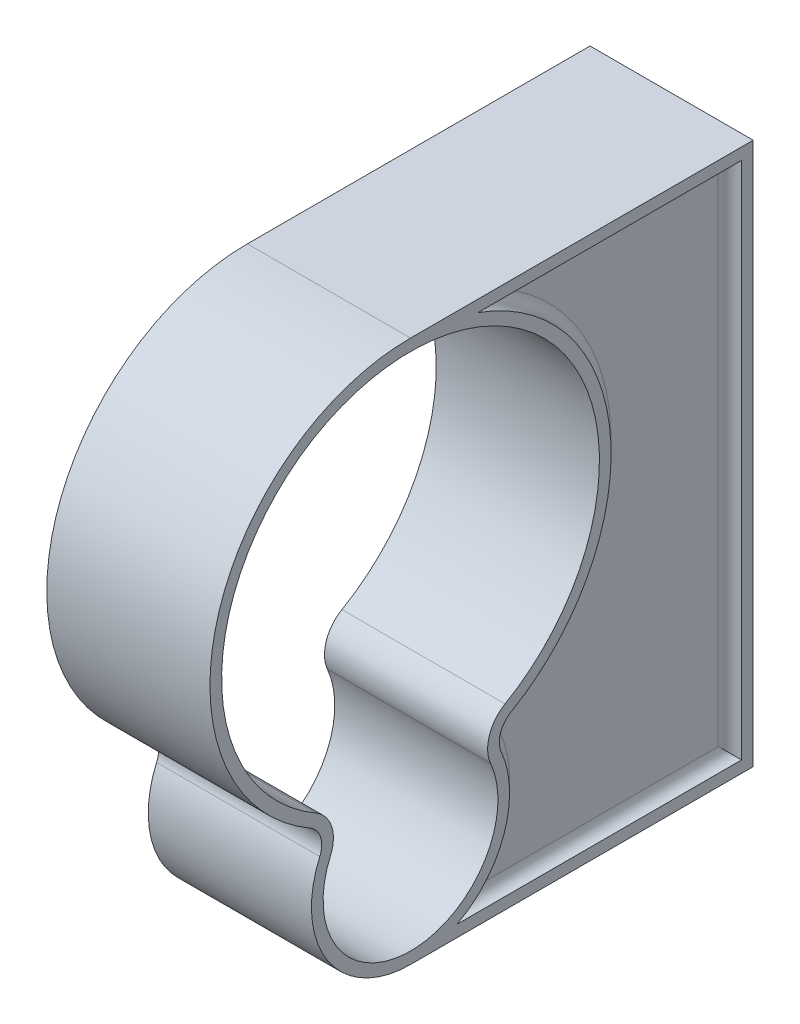
from build123d import *

# Parameters (mm, degrees)
BOSS_EXTRUDE1_DEPTH = 140
SKETCH2_R           = 15
CUT_EXTRUDE1_DEPTH  = 140
CUT_EXTRUDE2_START  = -10
CUT_EXTRUDE2_DEPTH  = 10
CUT_EXTRUDE3_DEPTH  = 10
FILLET1_R           = 10


with BuildPart() as part:
    # Sketch1 → Boss-Extrude1 (new body)
    with BuildSketch(Plane(origin=(0, 0, 0), x_dir=(0, 0, -1), z_dir=(1, 0, 0))):
        with BuildLine():
            Line((0, -120.66577438), (293.9982389, -120.66577438))
            Line((293.9982389, -120.66577438), (293.9982389, 344.79792692))
            Line((293.9982389, 344.79792692), (0, 344.79792692))
            ThreePointArc((0, 344.79792692), (-166.188863738, 217.33208751), (-86.160329475, 23.781803731))
            ThreePointArc((-86.160329475, 23.781803731), (-77.169593528, 12.698658653), (-77.855834661, -1.556112857))
            ThreePointArc((-77.855834661, -1.556112857), (-71.148862357, -82.172111425), (0, -120.66577438))
        make_face()
        with BuildLine():
            ThreePointArc((81.153066922, 32.43786067), (0, 334.79792692), (-81.153066922, 32.43786067))
            ThreePointArc((-81.153066922, 32.43786067), (-67.666963002, 15.813143052), (-68.696324701, -5.569014213))
            ThreePointArc((-68.696324701, -5.569014213), (0, -110.66577438), (68.696324701, -5.569014213))
            ThreePointArc((68.696324701, -5.569014213), (67.666963002, 15.813143052), (81.153066922, 32.43786067))
        make_face(mode=Mode.SUBTRACT)
    extrude(amount=BOSS_EXTRUDE1_DEPTH)

    # Sketch2 → Cut-Extrude1 (cut)
    with BuildSketch(Plane(origin=(0, 0, -293.9982389), x_dir=(-1, 0, 0), z_dir=(0, 0, -1))):
        with Locations((-110, 314.79792692)):
            Circle(SKETCH2_R)
        with Locations((-30, -90.66577438)):
            Circle(SKETCH2_R)
        with Locations((-110, -90.66577438)):
            Circle(SKETCH2_R)
        with Locations((-30, 314.79792692)):
            Circle(SKETCH2_R)
    extrude(amount=-CUT_EXTRUDE1_DEPTH, mode=Mode.SUBTRACT)

    # Sketch3 → Cut-Extrude2 (cut)
    with BuildSketch(Plane(origin=(140, 0, 0), x_dir=(0, 0, -1), z_dir=(1, 0, 0)).offset(CUT_EXTRUDE2_START)):
        with BuildLine():
            Line((40, -110.66577438), (283.9982389, -110.66577438))
            Line((283.9982389, -110.66577438), (283.9982389, 334.79792692))
            Line((283.9982389, 334.79792692), (57.804969406, 334.79792692))
            ThreePointArc((57.804969406, 334.79792692), (171.360027548, 188.350107316), (86.160329475, 23.781803731))
            ThreePointArc((86.160329475, 23.781803731), (77.169593528, 12.698658653), (77.855834661, -1.556112857))
            ThreePointArc((77.855834661, -1.556112857), (80.303978733, -63.527414671), (40, -110.66577438))
        make_face()
    extrude(amount=CUT_EXTRUDE2_DEPTH, mode=Mode.SUBTRACT)

    # Sketch4 → Cut-Extrude3 (cut)
    with BuildSketch(Plane.ZY):
        with BuildLine():
            Line((-57.804969406, 334.79792692), (-283.9982389, 334.79792692))
            Line((-283.9982389, 334.79792692), (-283.9982389, -110.66577438))
            Line((-283.9982389, -110.66577438), (-40, -110.66577438))
            ThreePointArc((-40, -110.66577438), (-80.303978733, -63.527414671), (-77.855834661, -1.556112857))
            ThreePointArc((-77.855834661, -1.556112857), (-77.169593528, 12.698658653), (-86.160329475, 23.781803731))
            ThreePointArc((-86.160329475, 23.781803731), (-171.360027548, 188.350107316), (-57.804969406, 334.79792692))
        make_face()
    extrude(amount=-CUT_EXTRUDE3_DEPTH, mode=Mode.SUBTRACT)

    # Fillet1
    fillet1_edges = [part.edges().sort_by_distance(p)[0] for p in [
        (130, 334.79792692, -170.901604153),
        (130, 112.06607627, -283.9982389),
        (130, -110.66577438, -161.99911945),
        (130, -63.527414671, -80.303978733),
        (130, 12.698658653, -77.169593528),
        (130, 188.350107316, -171.360027548),
        (10, 12.698658653, -77.169593528),
        (10, -63.527414671, -80.303978733),
        (10, -110.66577438, -161.99911945),
        (10, 112.06607627, -283.9982389),
        (10, 334.79792692, -170.901604153),
        (10, 188.350107316, -171.360027548),
    ]]
    fillet(fillet1_edges, radius=FILLET1_R - 0.0001)  # a hair under: the kernel refuses the full size


solid = part.part
